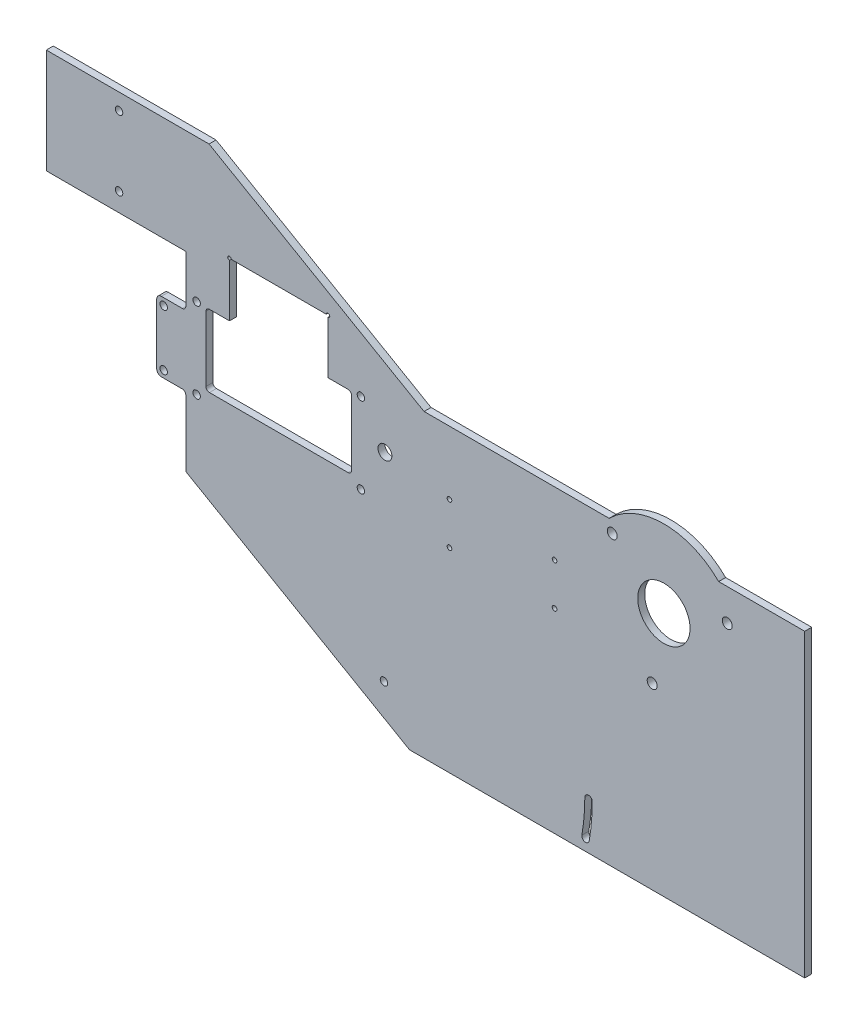
from build123d import *

# Parameters (mm, degrees)
SKETCH1_W           = 184.414327478
SKETCH1_H           = 83.61431582
BOSS_EXTRUDE1_DEPTH = 3
SKETCH2_R           = 3
CUT_EXTRUDE1_DEPTH  = 70
SKETCH3_R           = 11.25
CUT_EXTRUDE2_DEPTH  = 3
SKETCH4_R           = 1.6
BOSS_EXTRUDE2_DEPTH = 3
CUT_EXTRUDE3_DEPTH  = 10
SKETCH6_R           = 1.6
CUT_EXTRUDE4_DEPTH  = 3
FILLET1_R           = 1.5
SKETCH7_R           = 1
CUT_EXTRUDE5_DEPTH  = 10
SKETCH8_R           = 1.6
CUT_EXTRUDE6_DEPTH  = 12
SKETCH9_R           = 2.15
CUT_EXTRUDE7_DEPTH  = 12
BOSS_EXTRUDE3_DEPTH = 3
SKETCH12_R          = 1.6
CUT_EXTRUDE8_DEPTH  = 10


with BuildPart() as part:
    # Sketch1 → Boss-Extrude1 (new body)
    with BuildSketch(Plane.XY):
        with Locations((112.494062572, 5.79284209)):
            Rectangle(SKETCH1_W, SKETCH1_H)
    extrude(amount=BOSS_EXTRUDE1_DEPTH)

    # Sketch2 → Cut-Extrude1 (cut)
    with BuildSketch(Plane(origin=(0, 0, 0), x_dir=(-1, 0, 0), z_dir=(0, 0, -1))):
        with Locations((-24.116880081, 24)):
            Circle(SKETCH2_R)
    extrude(amount=-CUT_EXTRUDE1_DEPTH, mode=Mode.SUBTRACT)

    # Sketch3 → Cut-Extrude2 (cut)
    with BuildSketch(Plane.XY.offset(3)):
        with Locations((144.116880081, 24)):
            Circle(SKETCH3_R)
    extrude(amount=-CUT_EXTRUDE2_DEPTH, mode=Mode.SUBTRACT)

    # Sketch4 → Boss-Extrude2 (add)
    with BuildSketch(Plane.XY.offset(3)):
        with BuildLine():
            Line((-61.543119919, 56), (-61.543119919, 34))
            Line((-61.543119919, 34), (-72.043119919, 34))
            ThreePointArc((-72.043119919, 34), (-73.457333481, 33.414213562), (-74.043119919, 32))
            Line((-74.043119919, 32), (-74.043119919, 6))
            ThreePointArc((-74.043119919, 6), (-73.457333481, 4.585786438), (-72.043119919, 4))
            Line((-72.043119919, 4), (-61.543119919, 4))
            Line((-61.543119919, 4), (-61.543119919, -26))
            Line((-61.543119919, -26), (34.701226311, -81.566699204))
            Line((34.701226311, -81.566699204), (204.701226311, -81.566699204))
            Line((204.701226311, -81.566699204), (204.701226311, -36.01431582))
            Line((204.701226311, -36.01431582), (20.286898833, -36.01431582))
            Line((20.286898833, -36.01431582), (20.286898833, 47.6))
            Line((20.286898833, 47.6), (40.948393205, 47.6))
            Line((40.948393205, 47.6), (-51.543119919, 101))
            Line((-51.543119919, 101), (-121.543119919, 101))
            Line((-121.543119919, 101), (-121.543119919, 56))
            Line((-121.543119919, 56), (-61.543119919, 56))
        make_face()
        with Locations((-71.043119919, 31)):
            Circle(SKETCH4_R, mode=Mode.SUBTRACT)
        with Locations((-71.043119919, 7)):
            Circle(SKETCH4_R, mode=Mode.SUBTRACT)
    extrude(amount=-BOSS_EXTRUDE2_DEPTH)

    # Sketch5 → Cut-Extrude3 (cut)
    with BuildSketch(Plane.XY.offset(3)):
        with BuildLine():
            Line((-51.373138671, 8.5), (8.286898833, 8.5))
            ThreePointArc((8.286898833, 8.5), (9.347559005, 8.939339828), (9.786898833, 10))
            Line((9.786898833, 10), (9.786898833, 38))
            ThreePointArc((9.786898833, 38), (9.347559005, 39.060660172), (8.286898833, 39.5))
            Line((8.286898833, 39.5), (-0.343119919, 39.5))
            Line((-0.343119919, 39.5), (-0.343119919, 62.05))
            ThreePointArc((-0.343119919, 62.05), (0.187210167, 63.330330086), (-1.093119919, 62.8))
            Line((-1.093119919, 62.8), (-41.993119919, 62.8))
            ThreePointArc((-41.993119919, 62.8), (-43.273450005, 63.330330086), (-42.743119919, 62.05))
            Line((-42.743119919, 62.05), (-42.743119919, 39.5))
            Line((-42.743119919, 39.5), (-51.373138671, 39.5))
            ThreePointArc((-51.373138671, 39.5), (-52.433798843, 39.060660172), (-52.873138671, 38))
            Line((-52.873138671, 38), (-52.873138671, 10))
            ThreePointArc((-52.873138671, 10), (-52.433798843, 8.939339828), (-51.373138671, 8.5))
        make_face()
    extrude(amount=-CUT_EXTRUDE3_DEPTH, mode=Mode.SUBTRACT)

    # Sketch6 → Cut-Extrude4 (cut)
    with BuildSketch(Plane.XY.offset(3)):
        with Locations((13.786898833, 5)):
            Circle(SKETCH6_R)
        with Locations((13.786898833, 39.6)):
            Circle(SKETCH6_R)
        with Locations((-56.873138671, 5)):
            Circle(SKETCH6_R)
        with Locations((-56.873138671, 39.6)):
            Circle(SKETCH6_R)
    extrude(amount=-CUT_EXTRUDE4_DEPTH, mode=Mode.SUBTRACT)

    # Fillet1
    fillet1_edges = [part.edges().sort_by_distance(p)[0] for p in [
        (-61.543119919, 4, 1.5),
        (-61.543119919, 34, 1.5),
    ]]
    fillet(fillet1_edges, radius=FILLET1_R)

    # Sketch7 → Cut-Extrude5 (cut)
    with BuildSketch(Plane.XY.offset(3)):
        with Locations((51.886898833, 2.333300796)):
            Circle(SKETCH7_R)
        with Locations((97.086898833, 2.333300796)):
            Circle(SKETCH7_R)
        with Locations((97.086898833, 20.333300796)):
            Circle(SKETCH7_R)
        with Locations((51.886898833, 20.333300796)):
            Circle(SKETCH7_R)
    extrude(amount=-CUT_EXTRUDE5_DEPTH, mode=Mode.SUBTRACT)

    # Sketch8 → Cut-Extrude6 (cut)
    with BuildSketch(Plane.XY.offset(3)):
        with Locations((-90.243119919, 94)):
            Circle(SKETCH8_R)
        with Locations((-90.243119919, 64)):
            Circle(SKETCH8_R)
    extrude(amount=-CUT_EXTRUDE6_DEPTH, mode=Mode.SUBTRACT)

    # Sketch9 → Cut-Extrude7 (cut)
    with BuildSketch(Plane(origin=(0, 0, 0), x_dir=(-1, 0, 0), z_dir=(0, 0, -1))):
        with Locations((-171.367966084, 33.918584156)):
            Circle(SKETCH9_R)
        with Locations((-121.901591231, 42.640840681)):
            Circle(SKETCH9_R)
        with Locations((-139.081082929, -4.559424837)):
            Circle(SKETCH9_R)
    extrude(amount=-CUT_EXTRUDE7_DEPTH, mode=Mode.SUBTRACT)

    # Sketch10 → Boss-Extrude3 (add)
    with BuildSketch(Plane(origin=(0, 0, 0), x_dir=(-1, 0, 0), z_dir=(0, 0, -1))):
        with BuildLine():
            Line((-167.680888654, 47.6), (-120.552871509, 47.6))
            ThreePointArc((-120.552871509, 47.6), (-144.116880081, 57.35), (-167.680888654, 47.6))
        make_face()
    extrude(amount=-BOSS_EXTRUDE3_DEPTH)

    # Sketch12 → Cut-Extrude8 (cut)
    with BuildSketch(Plane.XY.offset(3)):
        with Locations((23.701226311, -61.566699204)):
            Circle(SKETCH12_R)
        with BuildLine():
            ThreePointArc((110.101226311, -61.566699204), (109.784541603, -68.957425033), (108.836808989, -76.293971931))
            ThreePointArc((108.836808989, -76.293971931), (110.140666581, -78.143284068), (111.989978718, -76.839426476))
            ThreePointArc((111.989978718, -76.839426476), (112.97281254, -69.231155619), (113.301226311, -61.566699204))
            ThreePointArc((113.301226311, -61.566699204), (111.701226311, -59.966699204), (110.101226311, -61.566699204))
        make_face()
    extrude(amount=-CUT_EXTRUDE8_DEPTH, mode=Mode.SUBTRACT)


solid = part.part
